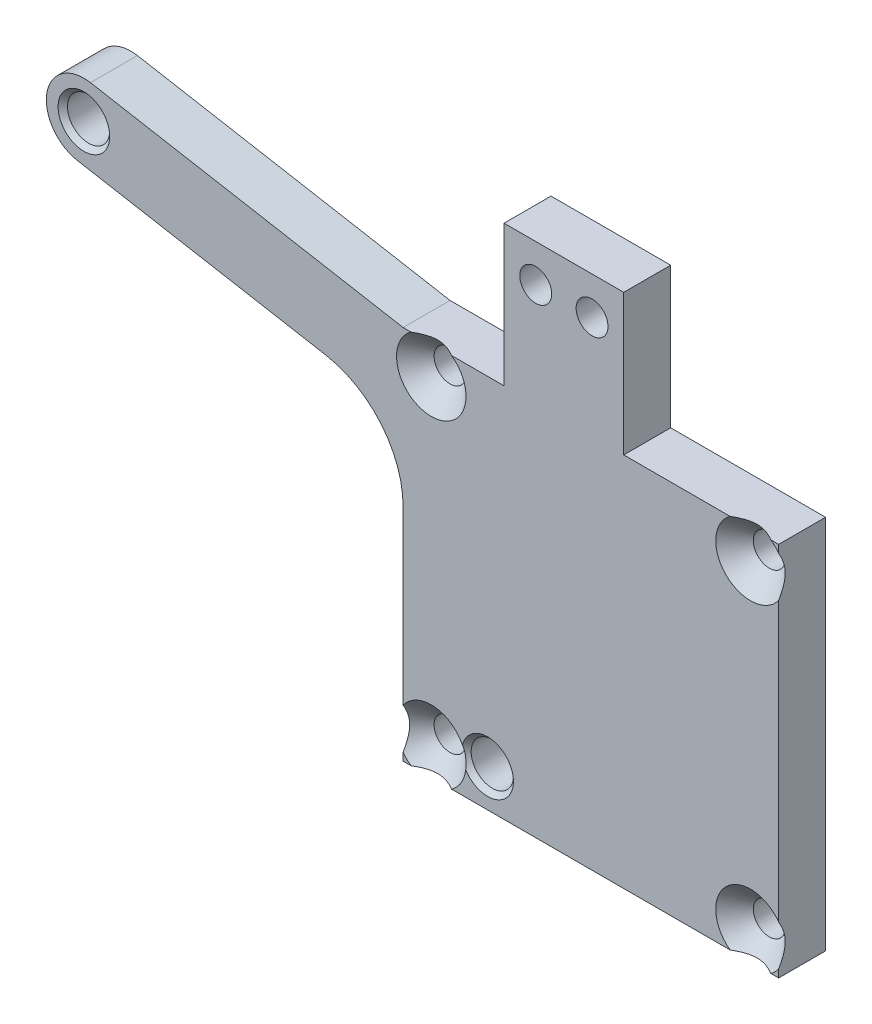
from build123d import *

# Parameters (mm, degrees)
SKETCH1_R           = 1.7
SKETCH1_R_2         = 2.25
BOSS_EXTRUDE1_DEPTH = 5
CHAMFER1_SIZE       = 2
CHAMFER2_SIZE       = 0.5


with BuildPart() as part:
    # Sketch1 → Boss-Extrude1 (new body)
    with BuildSketch(Plane.XY):
        with BuildLine():
            Line((3.5, 20), (3.5, 35))
            Line((3.5, 35), (-9.25, 35))
            Line((-9.25, 35), (-9.25, 20))
            Line((-9.25, 20), (-20, 20))
            Line((-20, 20), (-53.297771938, 25.937877061))
            ThreePointArc((-53.297771938, 25.937877061), (-57.937877061, 22.702228062), (-54.702228062, 18.062122939))
            Line((-54.702228062, 18.062122939), (-28.244429844, 13.343994848))
            ThreePointArc((-28.244429844, 13.343994848), (-22.333328572, 9.919749939), (-20, 3.499302196))
            Line((-20, 3.499302196), (-20, -20))
            Line((-20, -20), (20, -20))
            Line((20, -20), (20, 20))
            Line((20, 20), (3.5, 20))
        make_face()
        with Locations((-17, 17)):
            Circle(SKETCH1_R, mode=Mode.SUBTRACT)
        with Locations((17, 17)):
            Circle(SKETCH1_R, mode=Mode.SUBTRACT)
        with Locations((17, -17)):
            Circle(SKETCH1_R, mode=Mode.SUBTRACT)
        with Locations((-17, -17)):
            Circle(SKETCH1_R, mode=Mode.SUBTRACT)
        with Locations((-5.875, 31)):
            Circle(SKETCH1_R, mode=Mode.SUBTRACT)
        with Locations((0.125, 31)):
            Circle(SKETCH1_R, mode=Mode.SUBTRACT)
        with Locations((-11, -16)):
            Circle(SKETCH1_R_2, mode=Mode.SUBTRACT)
        with Locations((-54, 22)):
            Circle(SKETCH1_R_2, mode=Mode.SUBTRACT)
    extrude(amount=BOSS_EXTRUDE1_DEPTH)

    # Chamfer1
    # the kernel refuses this chamfer: 2 mm, written as the material it takes off along each edge
    with BuildSketch(Plane(origin=(-17, 17, 5), x_dir=(1, 0, 0), z_dir=(0, -1, 0))) as chamfer1_piece_1:
        Polygon((1.7, -CHAMFER1_SIZE), (1.7 + CHAMFER1_SIZE, 0), (1.7, 0), align=None)
    revolve(axis=Axis((-17, 17, 5), (0, 0, 1)), mode=Mode.SUBTRACT)
    with BuildSketch(Plane(origin=(17, 17, 5), x_dir=(1, 0, 0), z_dir=(0, -1, 0))) as chamfer1_piece_2:
        Polygon((1.7, -CHAMFER1_SIZE), (1.7 + CHAMFER1_SIZE, 0), (1.7, 0), align=None)
    revolve(axis=Axis((17, 17, 5), (0, 0, 1)), mode=Mode.SUBTRACT)
    with BuildSketch(Plane(origin=(17, -17, 5), x_dir=(1, 0, 0), z_dir=(0, -1, 0))) as chamfer1_piece_3:
        Polygon((1.7, -CHAMFER1_SIZE), (1.7 + CHAMFER1_SIZE, 0), (1.7, 0), align=None)
    revolve(axis=Axis((17, -17, 5), (0, 0, 1)), mode=Mode.SUBTRACT)
    with BuildSketch(Plane(origin=(-17, -17, 5), x_dir=(1, 0, 0), z_dir=(0, -1, 0))) as chamfer1_piece_4:
        Polygon((1.7, -CHAMFER1_SIZE), (1.7 + CHAMFER1_SIZE, 0), (1.7, 0), align=None)
    revolve(axis=Axis((-17, -17, 5), (0, 0, 1)), mode=Mode.SUBTRACT)

    # Chamfer2
    # the kernel refuses this chamfer: 0.5 mm, written as the material it takes off along each edge
    with BuildSketch(Plane(origin=(-11, -16, 5), x_dir=(1, 0, 0), z_dir=(0, -1, 0))) as chamfer2_piece_1:
        Polygon((2.25 + CHAMFER2_SIZE, 0), (2.25, -CHAMFER2_SIZE), (2.25, 0), align=None)
    revolve(axis=Axis((-11, -16, 5), (0, 0, 1)), mode=Mode.SUBTRACT)
    with BuildSketch(Plane(origin=(-54, 22, 5), x_dir=(1, 0, 0), z_dir=(0, -1, 0))) as chamfer2_piece_2:
        Polygon((2.25 + CHAMFER2_SIZE, 0), (2.25, -CHAMFER2_SIZE), (2.25, 0), align=None)
    revolve(axis=Axis((-54, 22, 5), (0, 0, 1)), mode=Mode.SUBTRACT)


solid = part.part
